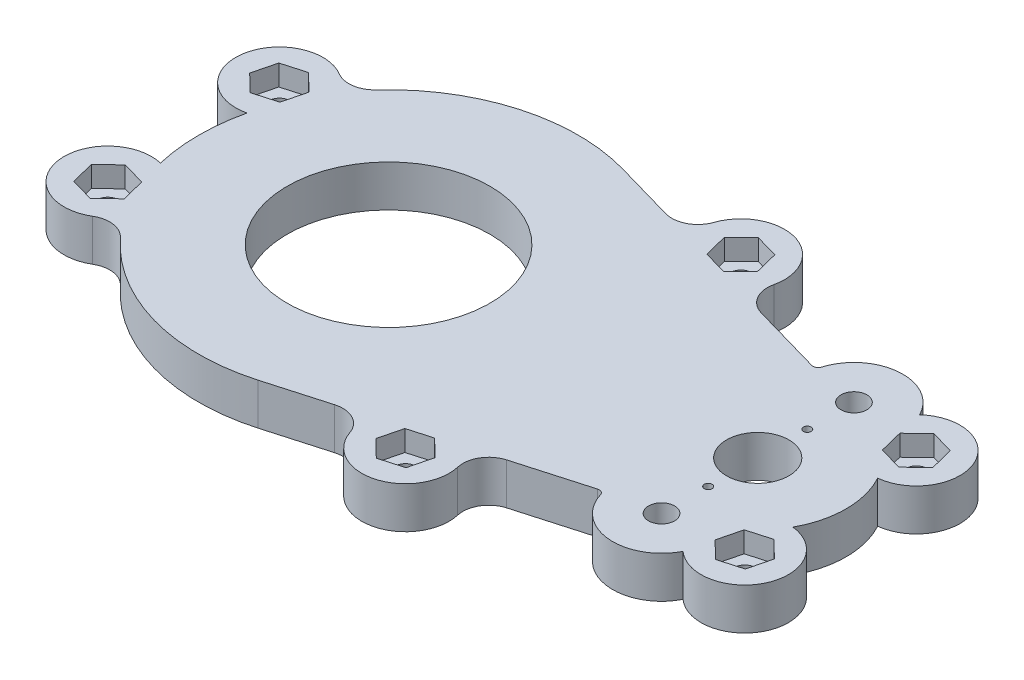
from build123d import *

# Parameters (mm, degrees)
SKETCH1_W               = 200
SKETCH1_H               = 150
SKETCH1_R               = 6
SKETCH1_R_2             = 13.5
SKETCH1_R_3             = 2
SKETCH1_R_4             = 2.5
BOSS_EXTRUDE1_DEPTH     = 4
SKETCH3_W               = 200
SKETCH3_H               = 150
BOSS_EXTRUDE2_DEPTH     = 8.25
SKETCH6_R               = 5.4
CUT_EXTRUDE2_DEPTH      = 8.25
FILLET1_R               = 2.5
FILLET2_R               = 5
SKETCH2_R               = 4.4
SKETCH2_R_2             = 5.4
CUT_EXTRUDE1_DEPTH      = 2
CUT_EXTRUDE3_DEPTH      = 126.598815828
CUT_EXTRUDE3_DEPTH_BACK = 126.598815828
SKETCH8_R               = 2
CUT_EXTRUDE6_DEPTH      = 126.598815818
CUT_EXTRUDE6_DEPTH_BACK = 126.598815818
SKETCH13_OUTSIDE_W      = 252.06
SKETCH13_OUTSIDE_H      = 202.06
FILLET4_R               = 5
CUT_EXTRUDE7_START      = -10.25
CUT_EXTRUDE7_DEPTH      = 10.25
SKETCH17_R              = 2
BOSS_EXTRUDE3_DEPTH     = 2
SKETCH18_R              = 13.5
SKETCH18_R_2            = 2
SKETCH18_R_3            = 2.5
SKETCH18_R_4            = 6
BOSS_EXTRUDE4_DEPTH     = 6
CUT_EXTRUDE8_DEPTH      = 92.336643939
CUT_EXTRUDE8_DEPTH_BACK = 92.336643939
SKETCH19_R              = 19.5
SKETCH19_R_2            = 0.75
CUT_EXTRUDE9_DEPTH      = 4
CUT_EXTRUDE10_DEPTH     = 4


with BuildPart() as part:
    # Sketch1 → Boss-Extrude1 (new body)
    with BuildSketch(Plane(origin=(0, 0, 0), x_dir=(1, 0, 0), z_dir=(0, 1, 0))):
        Rectangle(SKETCH1_W, SKETCH1_H)
        with Locations(Location((35.5, 0, 0), (0, 0, 270))):
            Circle(SKETCH1_R, mode=Mode.SUBTRACT)
        with Locations(Location((-35.5, 0, 0), (0, 0, 270))):
            Circle(SKETCH1_R_2, mode=Mode.SUBTRACT)
        with Locations(Location((-60.5, 0, 0), (0, 0, 270))):
            Circle(SKETCH1_R_3, mode=Mode.SUBTRACT)
        with Locations(Location((-35.5, 25, 0), (0, 0, 270))):
            Circle(SKETCH1_R_3, mode=Mode.SUBTRACT)
        with Locations(Location((-10.5, 0, 0), (0, 0, 270))):
            Circle(SKETCH1_R_3, mode=Mode.SUBTRACT)
        with Locations(Location((-35.5, -25, 0), (0, 0, 270))):
            Circle(SKETCH1_R_3, mode=Mode.SUBTRACT)
        with Locations(Location((35.5, 18.5, 0), (0, 0, 270))):
            Circle(SKETCH1_R_4, mode=Mode.SUBTRACT)
        with Locations(Location((35.5, -18.5, 0), (0, 0, 90))):
            Circle(SKETCH1_R_4, mode=Mode.SUBTRACT)
        Polygon((4.517711304, -15.136418767), (0.159242352, 0.258507293), (4.681501882, 1.538807548), (9.039970835, -13.856118512), (9.584779454, -15.78048427), (5.062519924, -17.060784524), align=None, mode=Mode.SUBTRACT)
    extrude(amount=BOSS_EXTRUDE1_DEPTH)

    # Sketch3 → Boss-Extrude2 (add)
    with BuildSketch(Plane(origin=(0, 4, 0), x_dir=(1, 0, 0), z_dir=(0, 1, 0))):
        Rectangle(SKETCH3_W, SKETCH3_H)
        with BuildLine():
            Line((-26.573943662, 31.250208291), (39.070422535, 12.500083317))
            ThreePointArc((39.070422535, 12.500083317), (48.5, 0), (39.070422535, -12.500083317))
            Line((39.070422535, -12.500083317), (-26.573943662, -31.250208291))
            ThreePointArc((-26.573943662, -31.250208291), (-68, 0), (-26.573943662, 31.250208291))
        make_face(mode=Mode.SUBTRACT)
    extrude(amount=BOSS_EXTRUDE2_DEPTH)

    # Sketch6 → Cut-Extrude2 (cut)
    with BuildSketch(Plane(origin=(0, 12.25, 0), x_dir=(1, 0, 0), z_dir=(0, 1, 0))):
        with Locations((35.5, 18.5)):
            Circle(SKETCH6_R)
        with Locations((35.5, -18.5)):
            Circle(SKETCH6_R)
    extrude(amount=-CUT_EXTRUDE2_DEPTH, mode=Mode.SUBTRACT)

    # Fillet1
    # the kernel refuses this fillet: 2.5 mm, written as the material it adds along each edge
    with BuildSketch(Plane(origin=(9.584779454, 0, 15.78048427), x_dir=(-0.9621828787440704, 0, 0.2724043095323078), z_dir=(0, 1, 0)), Plane(origin=(5.062519924, 0, 17.060784524), x_dir=(-0.2724043095323296, 0, -0.9621828787440644), z_dir=(0, 1, 0)), Plane(origin=(4.681501882, 0, -1.538807548), x_dir=(0.2724043095323091, 0, 0.96218287874407), z_dir=(0, 1, 0))) as fillet1_piece_1:
        with BuildLine():
            CenterArc((FILLET1_R, -FILLET1_R), FILLET1_R, 90, 90)
            Line((0, -FILLET1_R), (0, 0))
            Line((0, 0), (FILLET1_R, 0))
        make_face()
    extrude(amount=4)
    with BuildSketch(Plane(origin=(0.159242352, 0, -0.258507293), x_dir=(0.272404309532306, 0, 0.962182878744071), z_dir=(0, 1, 0))) as fillet1_piece_2:
        with BuildLine():
            CenterArc((FILLET1_R, FILLET1_R), FILLET1_R, 180, 90)
            Line((0, FILLET1_R), (0, 0))
            Line((0, 0), (FILLET1_R, 0))
        make_face()
    extrude(amount=4)

    # Fillet2
    fillet2_edges = [part.edges().sort_by_distance(p)[0] for p in [
        (31.784909874, 8.125, 14.581058133),
        (36.584743308, 8.125, 13.210072594),
        (36.584743308, 8.125, -13.210072594),
        (31.784909874, 8.125, -14.581058133),
    ]]
    fillet(fillet2_edges, radius=FILLET2_R)

    # Sketch2 → Cut-Extrude1 (cut)
    with BuildSketch(Plane(origin=(0, 4, 0), x_dir=(1, 0, 0), z_dir=(0, 1, 0))):
        with Locations(Location((-35.5, 25, 0), (0, 0, 270))):
            Circle(SKETCH2_R)
        with Locations(Location((-10.5, 0, 0), (0, 0, 270))):
            Circle(SKETCH2_R)
        with Locations(Location((-35.5, -25, 0), (0, 0, 270))):
            Circle(SKETCH2_R)
        with Locations(Location((-60.5, 0, 0), (0, 0, 270))):
            Circle(SKETCH2_R)
        with Locations(Location((35.5, 18.5, 0), (0, 0, 270))):
            Circle(SKETCH2_R_2)
        with Locations(Location((35.5, -18.5, 0), (0, 0, 197.105868404))):
            Circle(SKETCH2_R_2)
    extrude(amount=-CUT_EXTRUDE1_DEPTH, mode=Mode.SUBTRACT)

    # Sketch8 → Cut-Extrude3 (cut, two sides: drawn at the far end of the back side and taken through both)
    with BuildSketch(Plane.XZ.offset(-CUT_EXTRUDE3_DEPTH_BACK)):
        with Locations(Location((49.5, 16.5, 0), (0, 0, 270))):
            Circle(SKETCH8_R)
        with Locations(Location((-73, 16.5, 0), (0, 0, 270))):
            Circle(SKETCH8_R)
        with Locations(Location((0, 32.25, 0), (0, 0, 270))):
            Circle(SKETCH8_R)
        with Locations(Location((-73, -16.5, 0), (0, 0, 270))):
            Circle(SKETCH8_R)
        with Locations(Location((0, -32.25, 0), (0, 0, 270))):
            Circle(SKETCH8_R)
        with Locations(Location((49.5, -16.5, 0), (0, 0, 270))):
            Circle(SKETCH8_R)
    extrude(amount=CUT_EXTRUDE3_DEPTH + CUT_EXTRUDE3_DEPTH_BACK, mode=Mode.SUBTRACT)

    # Sketch13 outside → Cut-Extrude6 (cut, two sides: drawn at the far end of the back side and taken through both)
    with BuildSketch(Plane(origin=(0, 12.25, 0), x_dir=(1, 0, 0), z_dir=(0, 1, 0)).offset(-CUT_EXTRUDE6_DEPTH_BACK)):
        Rectangle(SKETCH13_OUTSIDE_W, SKETCH13_OUTSIDE_H)
        with BuildLine():
            Line((-8.131291348, 30.142370761), (-25.475352113, 35.096387773))
            ThreePointArc((-25.475352113, 35.096387773), (-47.910899113, 34.325203324), (-65.651791262, 20.569868344))
            ThreePointArc((-65.651791262, 20.569868344), (-80.688646272, 19.88300436), (-71.036099712, 8.332803684))
            ThreePointArc((-71.036099712, 8.332803684), (-72, 0), (-71.036099712, -8.332803684))
            ThreePointArc((-71.036099712, -8.332803684), (-80.688646272, -19.88300436), (-65.651791262, -20.569868344))
            ThreePointArc((-65.651791262, -20.569868344), (-47.910899113, -34.325203324), (-25.475352113, -35.096387773))
            Line((-25.475352113, -35.096387773), (-8.131291348, -30.142370761))
            ThreePointArc((-8.131291348, -30.142370761), (2.307042254, -40.326976912), (5.791389082, -26.165609111))
            Line((5.791389082, -26.165609111), (25.285418022, -20.597492606))
            ThreePointArc((25.285418022, -20.597492606), (26.036864948, -20.680025145), (26.515828803, -21.264899257))
            ThreePointArc((26.515828803, -21.264899257), (34.700336728, -27.865924335), (43.885416553, -22.74791587))
            ThreePointArc((43.885416553, -22.74791587), (57.167099831, -19.931556524), (50.418811796, -8.150402112))
            ThreePointArc((50.418811796, -8.150402112), (52.5, 0), (50.418811796, 8.150402112))
            ThreePointArc((50.418811796, 8.150402112), (57.167099831, 19.931556524), (43.885416553, 22.74791587))
            ThreePointArc((43.885416553, 22.74791587), (34.700336728, 27.865924335), (26.515828803, 21.264899257))
            ThreePointArc((26.515828803, 21.264899257), (26.036864948, 20.680025145), (25.285418022, 20.597492606))
            Line((25.285418022, 20.597492606), (5.791389082, 26.165609111))
            ThreePointArc((5.791389082, 26.165609111), (2.307042254, 40.326976912), (-8.131291348, 30.142370761))
        make_face(mode=Mode.SUBTRACT)
    extrude(amount=CUT_EXTRUDE6_DEPTH + CUT_EXTRUDE6_DEPTH_BACK, mode=Mode.SUBTRACT)

    # Fillet4
    fillet4_edges = [part.edges().sort_by_distance(p)[0] for p in [
        (-65.651791262, 6.125, -20.569868344),
        (-8.131291348, 6.125, -30.142370761),
        (5.791389082, 6.125, -26.165609111),
        (5.791389082, 6.125, 26.165609111),
        (-8.131291348, 6.125, 30.142370761),
        (-65.651791262, 6.125, 20.569868344),
    ]]
    fillet(fillet4_edges, radius=FILLET4_R)

    # Sketch16 → Cut-Extrude7 (cut)
    with BuildSketch(Plane(origin=(0, 12.25, 0), x_dir=(1, 0, 0), z_dir=(0, 1, 0)).offset(CUT_EXTRUDE7_START)):
        with BuildLine():
            Line((-25.475352113, -35.096387773), (-14.034980843, -31.828652803))
            ThreePointArc((-14.034980843, -31.828652803), (-10.35487685, -32.200345605), (-7.937211031, -34.999669261))
            ThreePointArc((-7.937211031, -34.999669261), (2.307042254, -40.326976912), (8.192079949, -30.392629249))
            ThreePointArc((8.192079949, -30.392629249), (8.766483762, -26.738675062), (11.695078578, -24.479327069))
            Line((11.695078578, -24.479327069), (25.285418022, -20.597492606))
            ThreePointArc((25.285418022, -20.597492606), (26.036864948, -20.680025145), (26.515828803, -21.264899257))
            ThreePointArc((26.515828803, -21.264899257), (34.700336728, -27.865924335), (43.885416553, -22.74791587))
            ThreePointArc((43.885416553, -22.74791587), (57.167099831, -19.931556524), (50.418811796, -8.150402112))
            ThreePointArc((50.418811796, -8.150402112), (52.5, 0), (50.418811796, 8.150402112))
            ThreePointArc((50.418811796, 8.150402112), (57.167099831, 19.931556524), (43.885416553, 22.74791587))
            ThreePointArc((43.885416553, 22.74791587), (34.700336728, 27.865924335), (26.515828803, 21.264899257))
            ThreePointArc((26.515828803, 21.264899257), (26.036864948, 20.680025145), (25.285418022, 20.597492606))
            Line((25.285418022, 20.597492606), (11.695078578, 24.479327069))
            ThreePointArc((11.695078578, 24.479327069), (8.766483762, 26.738675062), (8.192079949, 30.392629249))
            ThreePointArc((8.192079949, 30.392629249), (2.307042254, 40.326976912), (-7.937211031, 34.999669261))
            ThreePointArc((-7.937211031, 34.999669261), (-10.35487685, 32.200345605), (-14.034980843, 31.828652803))
            Line((-14.034980843, 31.828652803), (-25.475352113, 35.096387773))
            ThreePointArc((-25.475352113, 35.096387773), (-45.44485792, 35.119080298), (-62.437574746, 24.629597374))
            ThreePointArc((-62.437574746, 24.629597374), (-65.401208588, 23.05656851), (-68.691961882, 23.711158546))
            ThreePointArc((-68.691961882, 23.711158546), (-81.304080467, 17.765799193), (-71.036099712, 8.332803684))
            ThreePointArc((-71.036099712, 8.332803684), (-72, 0), (-71.036099712, -8.332803684))
            ThreePointArc((-71.036099712, -8.332803684), (-81.304080467, -17.765799193), (-68.691961882, -23.711158546))
            ThreePointArc((-68.691961882, -23.711158546), (-65.401208588, -23.05656851), (-62.437574746, -24.629597374))
            ThreePointArc((-62.437574746, -24.629597374), (-45.44485792, -35.119080298), (-25.475352113, -35.096387773))
        make_face()
    extrude(amount=CUT_EXTRUDE7_DEPTH, mode=Mode.SUBTRACT)

    # Sketch17 → Boss-Extrude3 (add)
    with BuildSketch(Plane.XZ):
        with Locations((-10.5, 0)):
            Circle(SKETCH17_R)
        with Locations((-35.5, -25)):
            Circle(SKETCH17_R)
        with Locations((-35.5, 25)):
            Circle(SKETCH17_R)
        with Locations((-60.5, 0)):
            Circle(SKETCH17_R)
        with BuildLine():
            Line((4.38150915, 14.655327328), (0.840253126, 2.146949904))
            ThreePointArc((0.840253126, 2.146949904), (1.027633585, 0.312624087), (2.421599042, -0.894323694))
            ThreePointArc((2.421599042, -0.894323694), (4.241377267, -0.597221274), (5.362512656, 0.866649649))
            Line((5.362512656, 0.866649649), (8.90376868, 13.375027073))
            ThreePointArc((8.90376868, 13.375027073), (8.71638822, 15.209352889), (7.322422764, 16.41630067))
            ThreePointArc((7.322422764, 16.41630067), (5.502644538, 16.11919825), (4.38150915, 14.655327328))
        make_face()
    extrude(amount=-BOSS_EXTRUDE3_DEPTH)

    # Sketch18 → Boss-Extrude4 (add)
    with BuildSketch(Plane(origin=(0, 2, 0), x_dir=(1, 0, 0), z_dir=(0, 1, 0))):
        with BuildLine():
            Line((-25.475352113, -35.096387773), (-14.034980843, -31.828652803))
            ThreePointArc((-14.034980843, -31.828652803), (-10.35487685, -32.200345605), (-7.937211031, -34.999669261))
            ThreePointArc((-7.937211031, -34.999669261), (2.307042254, -40.326976912), (8.192079949, -30.392629249))
            ThreePointArc((8.192079949, -30.392629249), (8.766483762, -26.738675062), (11.695078578, -24.479327069))
            Line((11.695078578, -24.479327069), (25.285418022, -20.597492606))
            ThreePointArc((25.285418022, -20.597492606), (26.036864948, -20.680025145), (26.515828803, -21.264899257))
            ThreePointArc((26.515828803, -21.264899257), (34.700336728, -27.865924335), (43.885416553, -22.74791587))
            ThreePointArc((43.885416553, -22.74791587), (57.167099831, -19.931556524), (50.418811796, -8.150402112))
            ThreePointArc((50.418811796, -8.150402112), (52.5, 0), (50.418811796, 8.150402112))
            ThreePointArc((50.418811796, 8.150402112), (57.167099831, 19.931556524), (43.885416553, 22.74791587))
            ThreePointArc((43.885416553, 22.74791587), (34.700336728, 27.865924335), (26.515828803, 21.264899257))
            ThreePointArc((26.515828803, 21.264899257), (26.036864948, 20.680025145), (25.285418022, 20.597492606))
            Line((25.285418022, 20.597492606), (11.695078578, 24.479327069))
            ThreePointArc((11.695078578, 24.479327069), (8.766483762, 26.738675062), (8.192079949, 30.392629249))
            ThreePointArc((8.192079949, 30.392629249), (2.307042254, 40.326976912), (-7.937211031, 34.999669261))
            ThreePointArc((-7.937211031, 34.999669261), (-10.35487685, 32.200345605), (-14.034980843, 31.828652803))
            Line((-14.034980843, 31.828652803), (-25.475352113, 35.096387773))
            ThreePointArc((-25.475352113, 35.096387773), (-45.44485792, 35.119080298), (-62.437574746, 24.629597374))
            ThreePointArc((-62.437574746, 24.629597374), (-65.401208588, 23.05656851), (-68.691961882, 23.711158546))
            ThreePointArc((-68.691961882, 23.711158546), (-81.304080467, 17.765799193), (-71.036099712, 8.332803684))
            ThreePointArc((-71.036099712, 8.332803684), (-72, 0), (-71.036099712, -8.332803684))
            ThreePointArc((-71.036099712, -8.332803684), (-81.304080467, -17.765799193), (-68.691961882, -23.711158546))
            ThreePointArc((-68.691961882, -23.711158546), (-65.401208588, -23.05656851), (-62.437574746, -24.629597374))
            ThreePointArc((-62.437574746, -24.629597374), (-45.44485792, -35.119080298), (-25.475352113, -35.096387773))
        make_face()
        with Locations(Location((-35.5, 0, 0), (0, 0, 270))):
            Circle(SKETCH18_R, mode=Mode.SUBTRACT)
        with Locations(Location((0, 32.25, 0), (0, 0, 90))):
            Circle(SKETCH18_R_2, mode=Mode.SUBTRACT)
        with Locations(Location((-73, 16.5, 0), (0, 0, 90))):
            Circle(SKETCH18_R_2, mode=Mode.SUBTRACT)
        with Locations(Location((-73, -16.5, 0), (0, 0, 90))):
            Circle(SKETCH18_R_2, mode=Mode.SUBTRACT)
        with Locations(Location((0, -32.25, 0), (0, 0, 90))):
            Circle(SKETCH18_R_2, mode=Mode.SUBTRACT)
        with Locations(Location((35.5, -18.5, 0), (0, 0, 90))):
            Circle(SKETCH18_R_3, mode=Mode.SUBTRACT)
        with Locations(Location((35.5, 0, 0), (0, 0, 270))):
            Circle(SKETCH18_R_4, mode=Mode.SUBTRACT)
        with Locations(Location((49.5, -16.5, 0), (0, 0, 90))):
            Circle(SKETCH18_R_2, mode=Mode.SUBTRACT)
        with Locations(Location((35.5, 18.5, 0), (0, 0, 270))):
            Circle(SKETCH18_R_3, mode=Mode.SUBTRACT)
        with Locations(Location((49.5, 16.5, 0), (0, 0, 90))):
            Circle(SKETCH18_R_2, mode=Mode.SUBTRACT)
    extrude(amount=BOSS_EXTRUDE4_DEPTH)

    # Sketch19 → Cut-Extrude8 (cut, two sides: drawn at the far end of the back side and taken through both)
    with BuildSketch(Plane.XZ.offset(-CUT_EXTRUDE8_DEPTH_BACK)):
        with Locations(Location((-35.5, 0, 0), (0, 0, 270))):
            Circle(SKETCH19_R)
        with Locations(Location((35.5, 9.525, 0), (0, 0, 270))):
            Circle(SKETCH19_R_2)
        with Locations(Location((35.5, -9.525, 0), (0, 0, 270))):
            Circle(SKETCH19_R_2)
    extrude(amount=CUT_EXTRUDE8_DEPTH + CUT_EXTRUDE8_DEPTH_BACK, mode=Mode.SUBTRACT)

    # Sketch20 → Cut-Extrude9 (cut)
    with BuildSketch(Plane.XZ):
        Polygon((40.118802154, 18.5), (37.809401077, 22.5), (33.190598923, 22.5), (30.881197846, 18.5), (33.190598923, 14.5), (37.809401077, 14.5), align=None)
        Polygon((40.118802154, -18.5), (37.809401077, -14.5), (33.190598923, -14.5), (30.881197846, -18.5), (33.190598923, -22.5), (37.809401077, -22.5), align=None)
    extrude(amount=-CUT_EXTRUDE9_DEPTH, mode=Mode.SUBTRACT)

    # Sketch21 → Cut-Extrude10 (cut)
    with BuildSketch(Plane(origin=(0, 8, 0), x_dir=(1, 0, 0), z_dir=(0, 1, 0))):
        Polygon((-69.680815691, 13.288092645), (-68.558814481, 17.768544253), (-71.87799879, 20.980451609), (-76.319184309, 19.711907355), (-77.441185519, 15.231455747), (-74.12200121, 12.019548391), align=None)
        Polygon((-69.680815691, -13.288092645), (-74.12200121, -12.019548391), (-77.441185519, -15.231455747), (-76.319184309, -19.711907355), (-71.87799879, -20.980451609), (-68.558814481, -17.768544253), align=None)
        Polygon((4.441185519, 30.981455747), (3.319184309, 35.461907355), (-1.12200121, 36.730451609), (-4.441185519, 33.518544253), (-3.319184309, 29.038092645), (1.12200121, 27.769548391), align=None)
        Polygon((50.62200121, 12.019548391), (53.941185519, 15.231455747), (52.819184309, 19.711907355), (48.37799879, 20.980451609), (45.058814481, 17.768544253), (46.180815691, 13.288092645), align=None)
        Polygon((53.941185519, -15.231455747), (50.62200121, -12.019548391), (46.180815691, -13.288092645), (45.058814481, -17.768544253), (48.37799879, -20.980451609), (52.819184309, -19.711907355), align=None)
        Polygon((4.441185519, -30.981455747), (1.12200121, -27.769548391), (-3.319184309, -29.038092645), (-4.441185519, -33.518544253), (-1.12200121, -36.730451609), (3.319184309, -35.461907355), align=None)
    extrude(amount=-CUT_EXTRUDE10_DEPTH, mode=Mode.SUBTRACT)


solid = part.part
